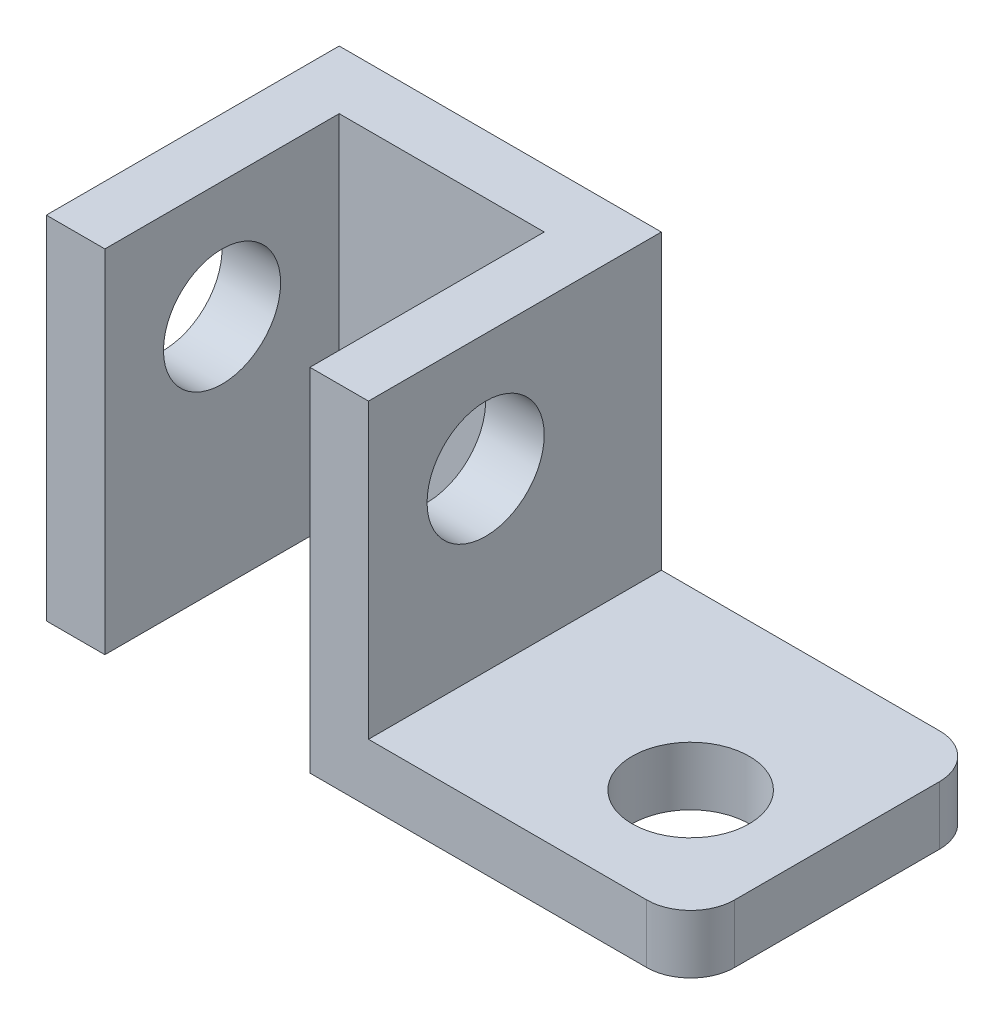
from build123d import *

# Parameters (mm, degrees)
EXTRUDE_1_DEPTH          = 120
SKETCH_1_4_R             = 20
EXTRUDE_1_2_DEPTH        = 20
CUT_EXTRUDE_1_DEPTH      = 270.814751265
CUT_EXTRUDE_1_DEPTH_BACK = 270.814751265
SKETCH_2_R               = 20


# Read off the part's stored shape, not the designer's step: 拉伸-薄壁1
with BuildPart() as part:
    # Extrude 1 outline → Extrude 1 (new body)
    with BuildSketch(Plane(origin=(0, 0, 0), x_dir=(1, 0, 0), z_dir=(0, 1, 0))):
        Polygon((-20, 0), (0, 0), (0, 80), (70, 80), (70, 0), (90, 0), (90, 100), (-20, 100), align=None)
    extrude(amount=EXTRUDE_1_DEPTH)

    # 草图1<4> → Extrude 1 2 (add)
    with BuildSketch(Plane(origin=(0, 0, 0), x_dir=(1, 0, 0), z_dir=(0, 1, 0))):
        with BuildLine():
            Line((90, 0), (185, 0))
            ThreePointArc((185, 0), (195.606601718, 4.393398282), (200, 15))
            Line((200, 15), (200, 85))
            ThreePointArc((200, 85), (195.606601718, 95.606601718), (185, 100))
            Line((185, 100), (90, 100))
            Line((90, 100), (90, 0))
        make_face()
        with Locations(Location((160, 40, 0), (0, 0, 270))):
            Circle(SKETCH_1_4_R, mode=Mode.SUBTRACT)
    extrude(amount=EXTRUDE_1_2_DEPTH)

    # 草图2 → 切除-拉伸1 (cut, two sides: drawn at the far end of the back side and taken through both)
    with BuildSketch(Plane.ZY.offset(20).offset(-CUT_EXTRUDE_1_DEPTH_BACK)):
        with Locations((-40, 80)):
            Circle(SKETCH_2_R)
    extrude(amount=CUT_EXTRUDE_1_DEPTH + CUT_EXTRUDE_1_DEPTH_BACK, mode=Mode.SUBTRACT)


solid = part.part
